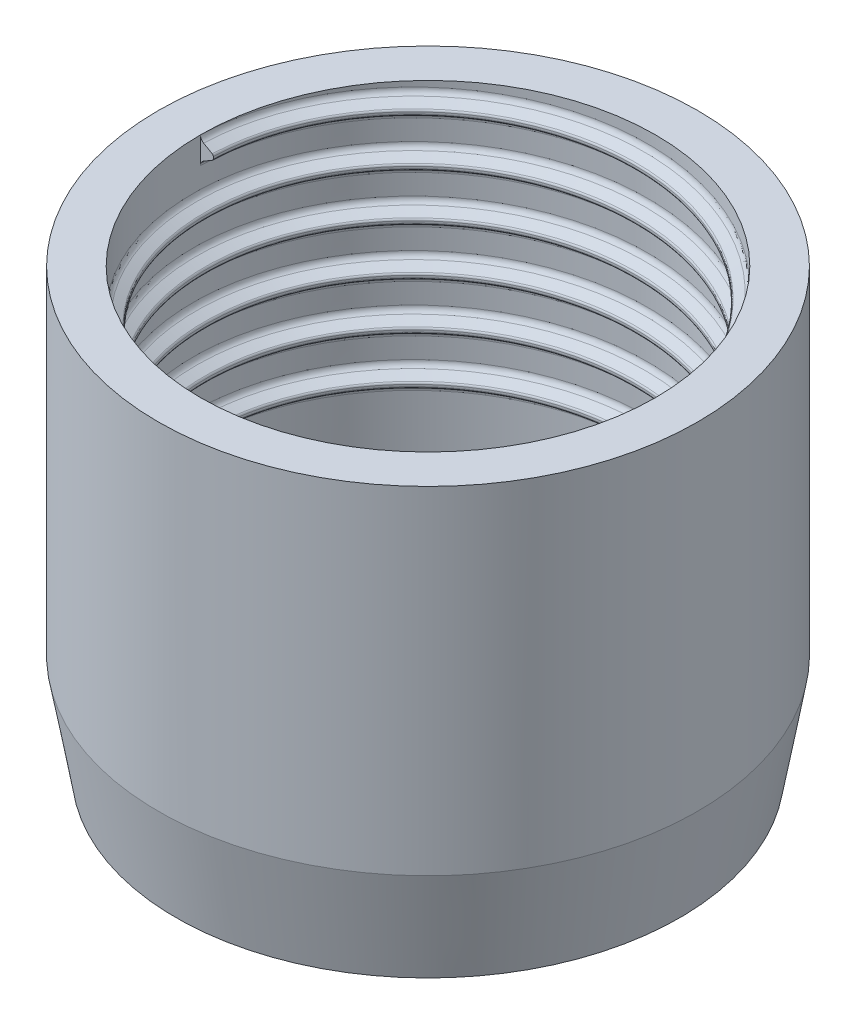
from build123d import *
from build123d.topology import SkipClean

# Parameters (mm, degrees)
SKETCH1_R           = 16
BOSS_EXTRUDE1_DEPTH = 20
SKETCH10_R          = 13.5
CUT_EXTRUDE2_DEPTH  = 20
THREAD1_PITCH       = 2.8
SKETCH20_R          = 16
BOSS_EXTRUDE3_DEPTH = 6
BOSS_EXTRUDE3_TAPER = 10
SKETCH19_R          = 6.55
CUT_EXTRUDE3_DEPTH  = 3
SKETCH127_R         = 5
CUT_EXTRUDE4_DEPTH  = 3


with BuildPart() as part:
    # Sketch1 → Boss-Extrude1 (new body)
    with BuildSketch(Plane(origin=(0, 0, 0), x_dir=(1, 0, 0), z_dir=(0, 1, 0))):
        with Locations(Location((0, 0, 0), (0, 0, 270))):
            Circle(SKETCH1_R)
    extrude(amount=BOSS_EXTRUDE1_DEPTH)

    # Sketch10 → Cut-Extrude2 (cut)
    with BuildSketch(Plane(origin=(0, 20, 0), x_dir=(1, 0, 0), z_dir=(0, 1, 0))):
        with Locations(Location((0, 0, 0), (0, 0, 270))):
            Circle(SKETCH10_R)
    extrude(amount=-CUT_EXTRUDE2_DEPTH, mode=Mode.SUBTRACT)

    # Thread1: the profile of Thread Profile2 profile screwed along a right-hand helix of 5.714286 turns, 10 arcs to a turn; built about Z, then put on its axis
    with SkipClean():  # the faces are left unmerged after this step: merging them gives an invalid solid
        thread1_z = Axis((0, 0, 0), (0, 0, 1))
        thread1_corners = [(13.5006, 0, 0), (13.5006, 0, 1.582940905), (13.5, 0, 1.582940905), (13.3095, 0, 1.252985226), (12.8015, 0, 0.95969129), (12.738, 0, 0.849706063), (12.738, 0, 0.733234842), (12.8015, 0, 0.623249616), (13.3095, 0, 0.329955679), (13.5, 0, 0)]
        with BuildLine(mode=Mode.PRIVATE) as thread1_profile:
            Line(thread1_corners[0], thread1_corners[1])
            Line(thread1_corners[3], thread1_corners[4])
            Line(thread1_corners[5], thread1_corners[6])
            Line(thread1_corners[7], thread1_corners[8])
            Line(thread1_corners[9], thread1_corners[0])
            Line(thread1_corners[2], thread1_corners[1])
            ThreePointArc((13.5, 0, 1.582940905), (13.448955679, 0, 1.392440905), (13.3095, 0, 1.252985226))
            ThreePointArc((12.8015, 0, 0.95969129), (12.755014774, 0, 0.913206063), (12.738, 0, 0.849706063))
            ThreePointArc((12.738, 0, 0.733234842), (12.755014774, 0, 0.669734842), (12.8015, 0, 0.623249616))
            ThreePointArc((13.3095, 0, 0.329955679), (13.448955679, 0, 0.1905), (13.5, 0, 0))
        thread1_cap = Face(thread1_profile.wire())
        thread1_arcs = [((13.5, 0, 1.582940905), (13.5, 0, 1.362970453), (13.3095, 0, 1.252985226), (1, 0.8660254037844384, 1)), ((12.8015, 0, 0.95969129), (12.738, 0, 0.923029547), (12.738, 0, 0.849706063), (1, 0.8660254037844415, 1)), ((12.738, 0, 0.733234842), (12.738, 0, 0.659911358), (12.8015, 0, 0.623249616), (1, 0.8660254037844367, 1)), ((13.3095, 0, 0.329955679), (13.5, 0, 0.219970453), (13.5, 0, 0), (1, 0.8660254037844375, 1))]  # start, shoulder, end, weights
        thread1_turn_angles = [0, 18, 36, 54, 72, 90, 108, 126, 144, 162, 180, 198, 216, 234, 252, 270, 288, 306, 324, 342, 360]
        thread1_turn_weights = [1, 0.9510565162951535, 1, 0.9510565162951535, 1, 0.9510565162951535, 1, 0.9510565162951535, 1, 0.9510565162951535, 1, 0.9510565162951535, 1, 0.9510565162951535, 1, 0.9510565162951535, 1, 0.9510565162951535, 1, 0.9510565162951535, 1]
        thread1_turn_rails = [Edge.make_bspline([Vector(p[0], p[1], 0).rotate(thread1_z, thread1_turn_angles[k]) / thread1_turn_weights[k] + Vector(0, 0, p[2] + THREAD1_PITCH * thread1_turn_angles[k] / 360) for k in range(21)], [0, 0, 0, 1, 1, 2, 2, 3, 3, 4, 4, 5, 5, 6, 6, 7, 7, 8, 8, 9, 9, 10, 10, 10], 2, thread1_turn_weights) for p in thread1_corners]
        thread1_turn_sides = [*[Face.make_surface_from_curves(thread1_turn_rails[p[0]], thread1_turn_rails[p[1]]) for p in [(0, 1), (3, 4), (5, 6), (7, 8), (9, 0), (2, 1)]], *[Face.make_bezier_surface([[Vector(p[j][0], p[j][1], 0).rotate(thread1_z, thread1_turn_angles[2 * i + k]) / thread1_turn_weights[2 * i + k] + Vector(0, 0, p[j][2] + THREAD1_PITCH * thread1_turn_angles[2 * i + k] / 360) for k in range(3)] for j in range(3)], [[p[3][j] * thread1_turn_weights[2 * i + k] for k in range(3)] for j in range(3)]) for p in thread1_arcs for i in range(10)]]
        thread1_last_angles = [1800, 1818, 1836, 1854, 1872, 1890, 1908, 1926, 1944, 1962, 1980, 1998, 2016, 2034, 2052, 2054.571428571, 2057.142857143]
        thread1_last_weights = [1, 0.9510565162951535, 1, 0.9510565162951535, 1, 0.9510565162951535, 1, 0.9510565162951535, 1, 0.9510565162951535, 1, 0.9510565162951535, 1, 0.9510565162951535, 1, 0.9989930665413146, 1]
        thread1_last_rails = [Edge.make_bspline([Vector(p[0], p[1], 0).rotate(thread1_z, thread1_last_angles[k]) / thread1_last_weights[k] + Vector(0, 0, p[2] + THREAD1_PITCH * thread1_last_angles[k] / 360) for k in range(17)], [0, 0, 0, 1, 1, 2, 2, 3, 3, 4, 4, 5, 5, 6, 6, 7, 7, 8, 8, 8], 2, thread1_last_weights) for p in thread1_corners]
        thread1_last_sides = [*[Face.make_surface_from_curves(thread1_last_rails[p[0]], thread1_last_rails[p[1]]) for p in [(0, 1), (3, 4), (5, 6), (7, 8), (9, 0), (2, 1)]], *[Face.make_bezier_surface([[Vector(p[j][0], p[j][1], 0).rotate(thread1_z, thread1_last_angles[2 * i + k]) / thread1_last_weights[2 * i + k] + Vector(0, 0, p[j][2] + THREAD1_PITCH * thread1_last_angles[2 * i + k] / 360) for k in range(3)] for j in range(3)], [[p[3][j] * thread1_last_weights[2 * i + k] for k in range(3)] for j in range(3)]) for p in thread1_arcs for i in range(8)]]
        thread1 = Plane(origin=(0, 20, 0), x_dir=(-1, 0, 0), z_dir=(0, -1, 0)) * Solid(Shell([*[p.moved(Location((0, 0, THREAD1_PITCH * i))) for i in range(5) for p in thread1_turn_sides], *thread1_last_sides, thread1_cap, thread1_cap.rotate(thread1_z, 2057.142857143).moved(Location((0, 0, THREAD1_PITCH * 2057.142857143 / 360)))]))
        add(thread1)

    # Sketch20 → Boss-Extrude3 (add)
    with SkipClean():  # the faces are left unmerged after this step: merging them gives an invalid solid
        with BuildSketch(Plane.XZ):
            with Locations(Location((0, 0, 0), (0, 0, 270))):
                Circle(SKETCH20_R)
        extrude(amount=BOSS_EXTRUDE3_DEPTH, taper=BOSS_EXTRUDE3_TAPER)

    # Sketch19 → Cut-Extrude3 (cut)
    with SkipClean():  # the faces are left unmerged after this step: merging them gives an invalid solid
        with BuildSketch(Plane(origin=(0, 0, 0), x_dir=(-1, 0, 0), z_dir=(0, -1, 0))):
            with Locations(Location((0, 0, 0), (0, 0, 90))):
                Circle(SKETCH19_R)
        extrude(amount=CUT_EXTRUDE3_DEPTH, mode=Mode.SUBTRACT)

    # Sketch127 → Cut-Extrude4 (cut)
    with SkipClean():  # the faces are left unmerged after this step: merging them gives an invalid solid
        with BuildSketch(Plane(origin=(0, -3, 0), x_dir=(1, 0, 0), z_dir=(0, 1, 0))):
            with Locations(Location((0, 0, 0), (0, 0, 270))):
                Circle(SKETCH127_R)
        extrude(amount=-CUT_EXTRUDE4_DEPTH, mode=Mode.SUBTRACT)


solid = part.part
